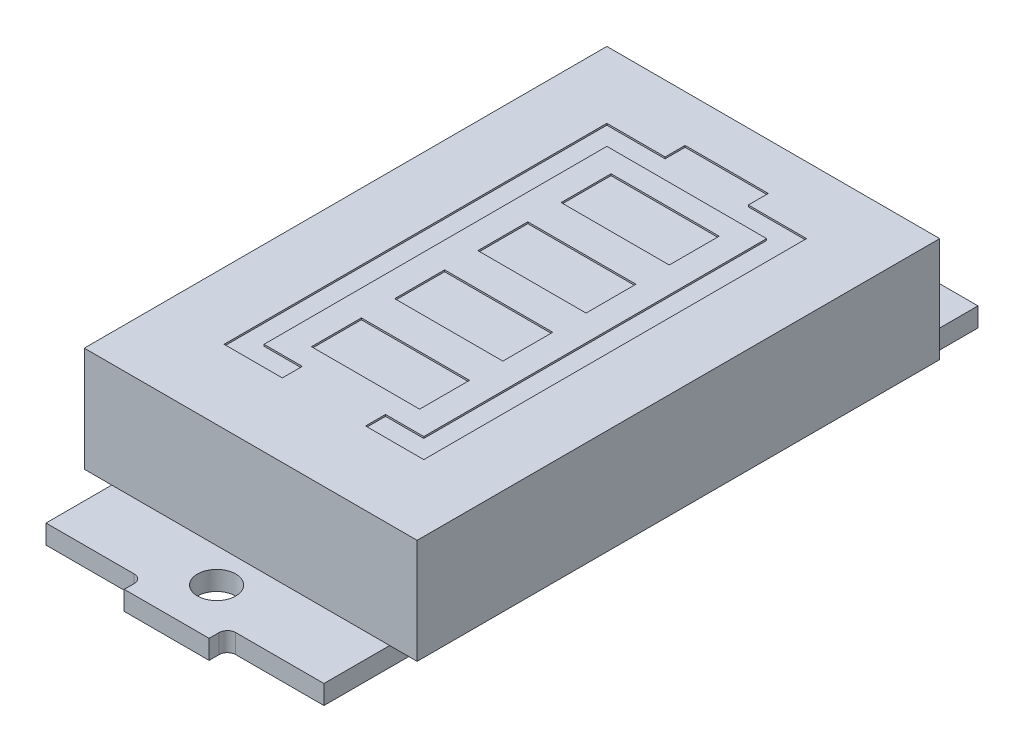
from build123d import *

# Parameters (mm, degrees)
ESQUISSE1_R             = 1.15
BOSS_EXTRU_1_DEPTH      = 1.15
CONG_1_R                = 0.5
ESQUISSE2_W             = 20
ESQUISSE2_H             = 31.4
BOSS_EXTRU_2_DEPTH      = 6.3
ESQUISSE4_W             = 6.5
ESQUISSE4_H             = 3
ENL_V_MAT_EXTRU_1_DEPTH = 0.1


with BuildPart() as part:
    # Esquisse1 → Boss.-Extru.1 (new body)
    with BuildSketch(Plane(origin=(0, 0, 0), x_dir=(1, 0, 0), z_dir=(0, 1, 0))):
        Polygon((-8.35, 19.65), (-8.35, -19.65), (-2.55, -19.65), (-2.55, -20.75), (2.55, -20.75), (2.55, -19.65), (8.35, -19.65), (8.35, 19.65), (2.55, 19.65), (2.55, 20.75), (-2.55, 20.75), (-2.55, 19.65), align=None)
        with Locations((0, -17.75)):
            Circle(ESQUISSE1_R, mode=Mode.SUBTRACT)
        with Locations((0, 17.75)):
            Circle(ESQUISSE1_R, mode=Mode.SUBTRACT)
    extrude(amount=BOSS_EXTRU_1_DEPTH)

    # Congé1
    cong_1_edges = [part.edges().sort_by_distance(p)[0] for p in [
        (-2.55, 0.575, -19.65),
        (2.55, 0.575, -19.65),
        (-2.55, 0.575, 19.65),
        (2.55, 0.575, 19.65),
    ]]
    fillet(cong_1_edges, radius=CONG_1_R)

    # Esquisse2 → Boss.-Extru.2 (add)
    with BuildSketch(Plane(origin=(0, 1.15, 0), x_dir=(1, 0, 0), z_dir=(0, 1, 0))):
        Rectangle(ESQUISSE2_W, ESQUISSE2_H)
    extrude(amount=BOSS_EXTRU_2_DEPTH)

    # Esquisse4 → Enlèv. mat.-Extru.1 (cut)
    with BuildSketch(Plane(origin=(0, 7.45, 0), x_dir=(1, 0, 0), z_dir=(0, 1, 0))):
        Polygon((-2.5, -11.3), (-2.5, -10.1), (-4.8, -10.1), (-4.8, 10.5), (4.8, 10.5), (4.8, -10.1), (2.5, -10.1), (2.5, -11.3), (6, -11.3), (6, 11.7), (2.5, 11.7), (2.5, 12.9), (-2.5, 12.9), (-2.5, 11.7), (-6, 11.7), (-6, -11.3), align=None)
        with Locations((0, 7.7)):
            Rectangle(ESQUISSE4_W, ESQUISSE4_H)
        with Locations((0, 2.7)):
            Rectangle(ESQUISSE4_W, ESQUISSE4_H)
        with Locations((0, -2.3)):
            Rectangle(ESQUISSE4_W, ESQUISSE4_H)
        with Locations((0, -7.3)):
            Rectangle(ESQUISSE4_W, ESQUISSE4_H)
    extrude(amount=-ENL_V_MAT_EXTRU_1_DEPTH, mode=Mode.SUBTRACT)


solid = part.part
